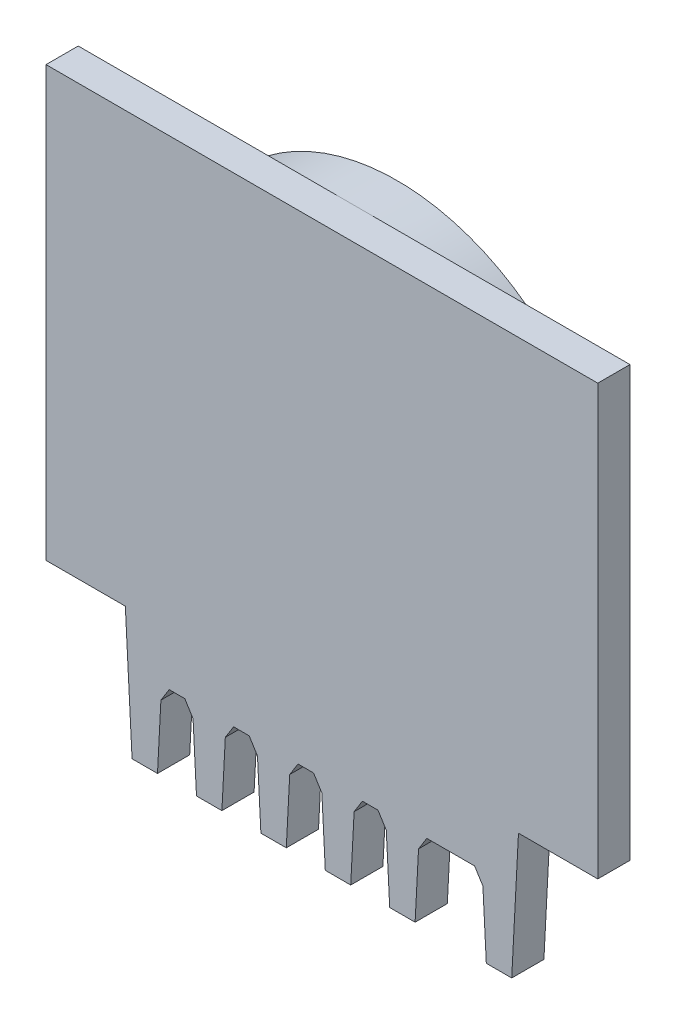
from build123d import *

# Parameters (mm, degrees)
BOSS_EXTRUDE1_DEPTH = 1.5
SKETCH10_R          = 10
BOSS_EXTRUDE2_DEPTH = 2


with BuildPart() as part:
    # Sketch1 → Boss-Extrude1 (new body)
    with BuildSketch(Plane.XY):
        Polygon((0, 6), (0.314446676, 0), (1.497941481, 0), (1.657221927, 3.039251967), (2.042586863, 3.65596478), (2.769801294, 3.65596478), (3.155166229, 3.039251967), (3.314446676, 0), (4.497941481, 0), (4.657221927, 3.039251967), (5.042586863, 3.65596478), (5.769801294, 3.65596478), (6.155166229, 3.039251967), (6.314446676, 0), (7.497941481, 0), (7.657221927, 3.039251967), (8.042586863, 3.65596478), (8.769801294, 3.65596478), (9.155166229, 3.039251967), (9.314446676, 0), (10.497941481, 0), (10.657221927, 3.039251967), (11.042586863, 3.65596478), (11.769801294, 3.65596478), (12.155166229, 3.039251967), (12.314446676, 0), (13.497941481, 0), (13.657221927, 3.039251967), (14.042586863, 3.65596478), (16.269801294, 3.65596478), (16.655166229, 3.039251967), (16.814446676, 0), (17.997941481, 0), (18.312388157, 6), (22.006194078, 6), (22.006194078, 26), (-3.693805922, 26), (-3.693805922, 6), align=None)
    extrude(amount=BOSS_EXTRUDE1_DEPTH)

    # Sketch10 → Boss-Extrude2 (add)
    with BuildSketch(Plane.XY):
        with Locations((9.156194078, 16)):
            Circle(SKETCH10_R)
    extrude(amount=-BOSS_EXTRUDE2_DEPTH)


solid = part.part
